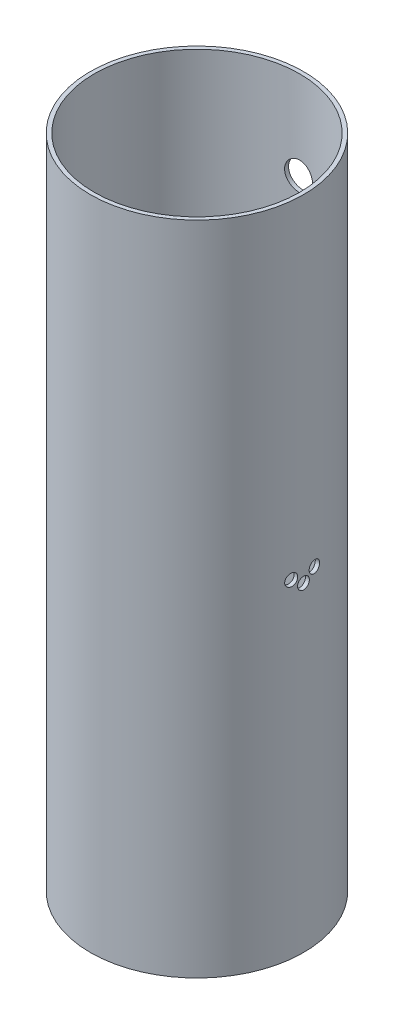
from build123d import *

# Parameters (mm, degrees)
SKETCH1_R                        = 49.5173
SKETCH1_R_2                      = 47.6885
BOSS_EXTRUDE1_DEPTH              = 152.4
SKETCH29_W                       = 6.54812
SKETCH29_H                       = 49.5173
F_1_2_CLEARANCE_HOLE8_AT_2_COUNT = 2
F_1_2_CLEARANCE_HOLE8_AT_2_PITCH = 222.123
CUT_SWEEP1_START                 = 47.609143269
CUT_SWEEP1_OUTLINE_R             = 2.749999961
CUT_SWEEP1_DEPTH                 = 1.908156784
SKETCH30_R                       = 2.749999961
CUT_EXTRUDE1_DEPTH               = 168.719068829
MIRROR2_START                    = 47.609143269
MIRROR2_COPY_1_SKETCH_R          = 2.749999961
MIRROR2_COPY_1_DEPTH             = 1.908156784
SKETCH30_2_R                     = 2.749999961
CUT_EXTRUDE2_DEPTH               = 168.719068829


# Read off the part's stored shape, not the designer's step: Cut-Sweep1
with BuildPart() as part:
    # Sketch1 → Boss-Extrude1 (new, symmetric)
    with BuildSketch(Plane(origin=(0, 0, 0), x_dir=(1, 0, 0), z_dir=(0, 1, 0))):
        with Locations(Location((0, 0, 0), (0, 0, 90))):
            Circle(SKETCH1_R)
        with Locations(Location((0, 0, 0), (0, 0, 90))):
            Circle(SKETCH1_R_2, mode=Mode.SUBTRACT)
    extrude(amount=BOSS_EXTRUDE1_DEPTH, both=True)

    # Sketch29 → 1/2 Clearance Hole8 (revolve, cut)
    with BuildSketch(Plane(origin=(0, 111.125, 0), x_dir=(0, -1, 0), z_dir=(1, 0, 0))):
        with Locations((3.27406, 24.75865)):
            Rectangle(SKETCH29_W, SKETCH29_H)
    f_1_2_clearance_hole8 = revolve(axis=Axis((0, 111.125, 6.35), (0, 0, -1)), mode=Mode.SUBTRACT)

    # 1/2 Clearance Hole8 at 2: 1/2 Clearance Hole8 ×2
    with Locations(*[(0, -i * F_1_2_CLEARANCE_HOLE8_AT_2_PITCH, 0) for i in range(1, F_1_2_CLEARANCE_HOLE8_AT_2_COUNT)]):
        add(f_1_2_clearance_hole8, mode=Mode.SUBTRACT)

    # Cut-Sweep1 outline → Cut-Sweep1 (cut)
    with BuildSketch(Plane(origin=(0, 0, 0), x_dir=(0, 1, 0), z_dir=(0.9940563382223195, 0, -0.10886687485196506)).offset(CUT_SWEEP1_START)):
        Circle(CUT_SWEEP1_OUTLINE_R)
    cut_sweep1 = extrude(amount=CUT_SWEEP1_DEPTH, mode=Mode.SUBTRACT)

    # Mirror1: Cut-Sweep1 across plane
    add(cut_sweep1.mirror(Plane(origin=(0, 0, 0), x_dir=(0, 0, 1), z_dir=(1, 0, 0))), mode=Mode.SUBTRACT)

    # Sketch30 → Cut-Extrude1 (cut, through all)
    with BuildSketch(Plane(origin=(0, 0, 0), x_dir=(0, 0, -1), z_dir=(1, 0, 0))):
        with Locations((0, 3.81)):
            Circle(SKETCH30_R)
    extrude(amount=-CUT_EXTRUDE1_DEPTH, mode=Mode.SUBTRACT)

    # Mirror2: Cut-Sweep1 across plane
    add(cut_sweep1.mirror(Plane.XY), mode=Mode.SUBTRACT)

    # Mirror2 copy 1 sketch → Mirror2 copy 1 (cut)
    with BuildSketch(Plane(origin=(0, 0, 0), x_dir=(0, 1, 0), z_dir=(-0.9940563382223195, 0, 0.10886687485196506)).offset(MIRROR2_START)):
        Circle(MIRROR2_COPY_1_SKETCH_R)
    extrude(amount=MIRROR2_COPY_1_DEPTH, mode=Mode.SUBTRACT)

    # Sketch30<2> → Cut-Extrude2 (cut, through all)
    with BuildSketch(Plane(origin=(0, 0, 0), x_dir=(0, 0, -1), z_dir=(1, 0, 0))):
        with Locations(Location((0, -3.81, 0), (0, 0, 180))):
            Circle(SKETCH30_2_R)
    extrude(amount=CUT_EXTRUDE2_DEPTH, mode=Mode.SUBTRACT)


solid = part.part
